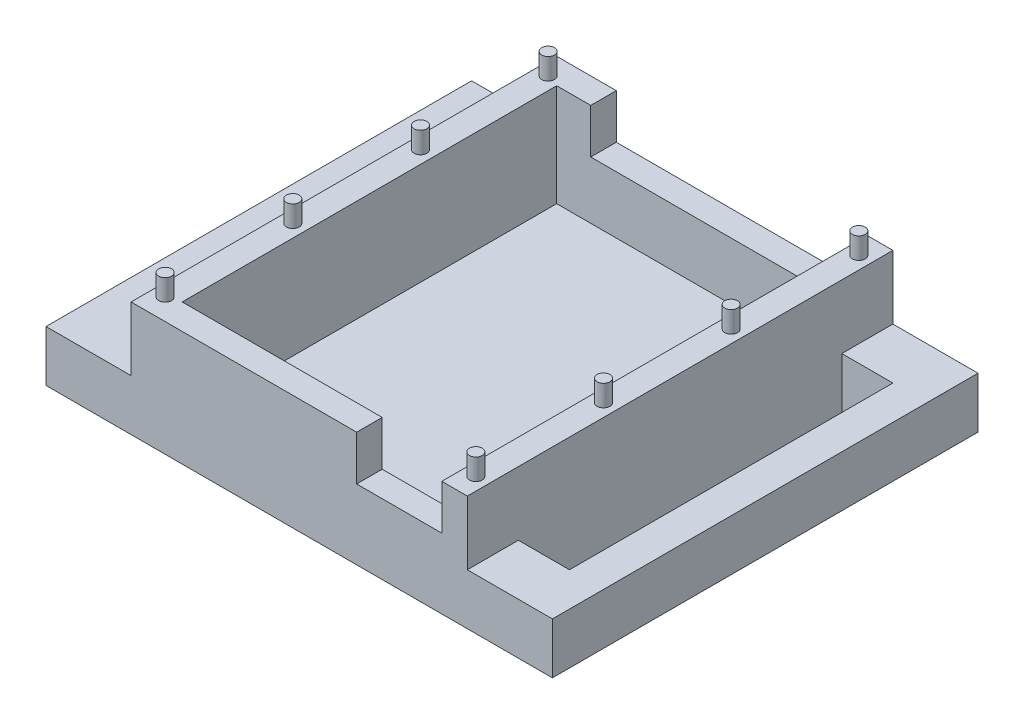
from build123d import *

# Parameters (mm, degrees)
SKETCH1_W           = 39.5
SKETCH1_H           = 50
BOSS_EXTRUDE1_DEPTH = 1.5
SKETCH3_W           = 39.5
SKETCH3_H           = 50
SKETCH3_W_2         = 33.5
SKETCH3_H_2         = 44
BOSS_EXTRUDE2_DEPTH = 12
SKETCH6_W           = 10
SKETCH6_H           = 6
CUT_EXTRUDE2_DEPTH  = 11.2
SKETCH7_W           = 29.5
SKETCH7_H           = 5.98
CUT_EXTRUDE3_DEPTH  = 3.3
SKETCH8_W           = 6
SKETCH8_H           = 6
BOSS_EXTRUDE3_DEPTH = 10
SKETCH9_W           = 4
SKETCH9_H           = 6
BOSS_EXTRUDE4_DEPTH = 38
SKETCH10_W          = 6
SKETCH10_H          = 6
BOSS_EXTRUDE5_DEPTH = 10
SKETCH11_W          = 4
SKETCH11_H          = 6
BOSS_EXTRUDE6_DEPTH = 38
SKETCH12_R          = 0.75
BOSS_EXTRUDE7_DEPTH = 2.5
LPATTERN1_COUNT     = 4
LPATTERN1_PITCH     = 15


with BuildPart() as part:
    # Sketch1 → Boss-Extrude1 (new body)
    with BuildSketch(Plane(origin=(0, 0, 0), x_dir=(1, 0, 0), z_dir=(0, 1, 0))):
        with Locations((19.75, 25)):
            Rectangle(SKETCH1_W, SKETCH1_H)
    extrude(amount=BOSS_EXTRUDE1_DEPTH)

    # Sketch3 → Boss-Extrude2 (add)
    with BuildSketch(Plane(origin=(0, 1.5, 0), x_dir=(1, 0, 0), z_dir=(0, 1, 0))):
        with Locations((19.75, 25)):
            Rectangle(SKETCH3_W, SKETCH3_H)
        with Locations((19.75, 25)):
            Rectangle(SKETCH3_W_2, SKETCH3_H_2, mode=Mode.SUBTRACT)
    extrude(amount=BOSS_EXTRUDE2_DEPTH)

    # Sketch6 → Cut-Extrude2 (cut)
    with BuildSketch(Plane.XY):
        with Locations((31.5, 11.23)):
            Rectangle(SKETCH6_W, SKETCH6_H)
    extrude(amount=-CUT_EXTRUDE2_DEPTH, mode=Mode.SUBTRACT)

    # Sketch7 → Cut-Extrude3 (cut)
    with BuildSketch(Plane(origin=(0, 0, -50), x_dir=(-1, 0, 0), z_dir=(0, 0, -1))):
        with Locations((-21.75, 11.24)):
            Rectangle(SKETCH7_W, SKETCH7_H)
    extrude(amount=-CUT_EXTRUDE3_DEPTH, mode=Mode.SUBTRACT)

    # Sketch8 → Boss-Extrude3 (add)
    with BuildSketch(Plane(origin=(39.5, 0, 0), x_dir=(0, 0, -1), z_dir=(1, 0, 0))):
        with Locations((3, 3)):
            Rectangle(SKETCH8_W, SKETCH8_H)
        with Locations((47, 3)):
            Rectangle(SKETCH8_W, SKETCH8_H)
    extrude(amount=BOSS_EXTRUDE3_DEPTH)

    # Sketch9 → Boss-Extrude4 (add)
    with BuildSketch(Plane.XY.offset(-44)):
        with Locations((47.5, 3)):
            Rectangle(SKETCH9_W, SKETCH9_H)
    extrude(amount=BOSS_EXTRUDE4_DEPTH)

    # Sketch10 → Boss-Extrude5 (add)
    with BuildSketch(Plane.ZY):
        with Locations((-47, 3)):
            Rectangle(SKETCH10_W, SKETCH10_H)
        with Locations((-3, 3)):
            Rectangle(SKETCH10_W, SKETCH10_H)
    extrude(amount=BOSS_EXTRUDE5_DEPTH)

    # Sketch11 → Boss-Extrude6 (add)
    with BuildSketch(Plane(origin=(0, 0, -6), x_dir=(-1, 0, 0), z_dir=(0, 0, -1))):
        with Locations((8, 3)):
            Rectangle(SKETCH11_W, SKETCH11_H)
    extrude(amount=BOSS_EXTRUDE6_DEPTH)

    # Sketch12 → Boss-Extrude7 (add)
    with BuildSketch(Plane(origin=(0, 13.5, 0), x_dir=(1, 0, 0), z_dir=(0, 1, 0))):
        with Locations((38, 2.5)):
            Circle(SKETCH12_R)
        with Locations((1.5, 2.5)):
            Circle(SKETCH12_R)
    boss_extrude7 = extrude(amount=BOSS_EXTRUDE7_DEPTH)

    # LPattern1: Boss-Extrude7 ×4
    with Locations(*[(0, 0, -i * LPATTERN1_PITCH) for i in range(1, LPATTERN1_COUNT)]):
        add(boss_extrude7)


solid = part.part
